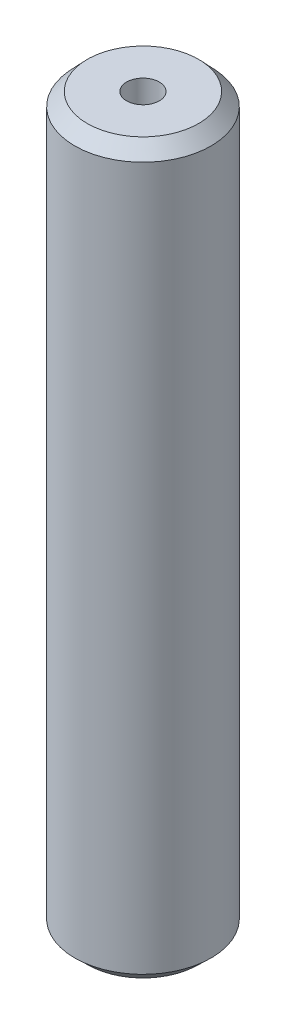
from build123d import *
from OCP.BRepFilletAPI import BRepFilletAPI_MakeChamfer

# Parameters (mm, degrees)
SKETCH1_R           = 5
BOSS_EXTRUDE1_DEPTH = 53.490048208
SKETCH2_R           = 1.200187698
CUT_EXTRUDE1_DEPTH  = 54.955400631
CHAMFER1_SIZE       = 0.965509557
CHAMFER1_SIZE2      = 0.916010629


with BuildPart() as part:
    # Sketch1 → Boss-Extrude1 (new body)
    with BuildSketch(Plane(origin=(0, 0, 0), x_dir=(1, 0, 0), z_dir=(0, 1, 0))):
        Circle(SKETCH1_R)
    extrude(amount=BOSS_EXTRUDE1_DEPTH)

    # Sketch2 → Cut-Extrude1 (cut, through all)
    with BuildSketch(Plane(origin=(0, 0, 0), x_dir=(1, 0, 0), z_dir=(0, 1, 0))):
        Circle(SKETCH2_R)
    extrude(amount=CUT_EXTRUDE1_DEPTH, mode=Mode.SUBTRACT)

    # Chamfer1: one chamfer whose edges measure the first distance from different faces: ONE call of the kernel's chamfer builder (chamfer() names one face for all edges)
    chamfer1_edges_1 = [part.edges().sort_by_distance(p)[0] for p in [
        (-5, 53.490048208, 0),
    ]]
    chamfer1_side_1 = [part.faces().sort_by_distance(p)[0] for p in [
        (-5, 26.745024104, 0),
    ]]
    chamfer1_edges_2 = [part.edges().sort_by_distance(p)[0] for p in [
        (-5, 0, 0),
    ]]
    chamfer1_side_2 = [part.faces().sort_by_distance(p)[0] for p in [
        (-4.858578644, 0, 0),
    ]]
    chamfer1 = BRepFilletAPI_MakeChamfer(part.part.solid().wrapped)
    for e in chamfer1_edges_1:
        chamfer1.Add(CHAMFER1_SIZE, CHAMFER1_SIZE2, e.wrapped, chamfer1_side_1[0].wrapped)  # the first distance lies on this face
    for e in chamfer1_edges_2:
        chamfer1.Add(CHAMFER1_SIZE, CHAMFER1_SIZE2, e.wrapped, chamfer1_side_2[0].wrapped)  # the first distance lies on this face
    add(Compound.cast(chamfer1.Shape()), mode=Mode.REPLACE)


solid = part.part
